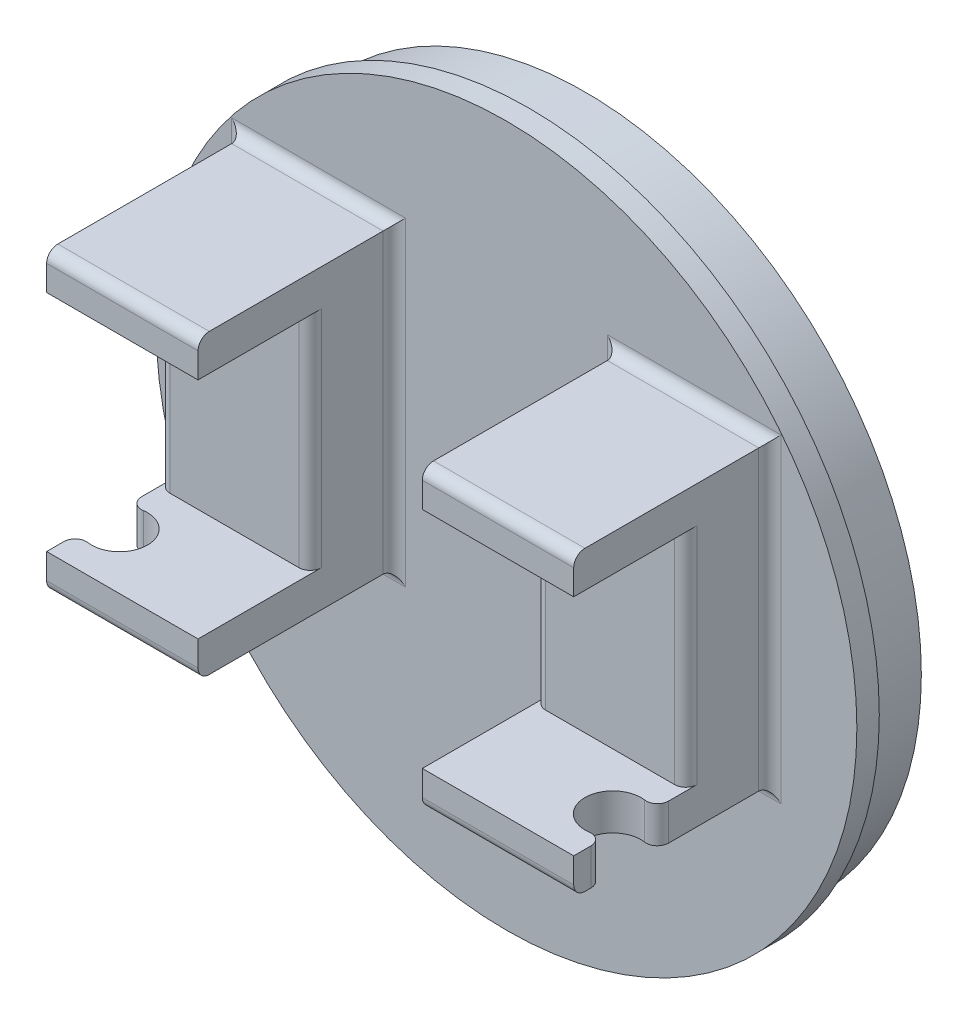
from build123d import *

# Parameters (mm, degrees)
SKETCH1_R           = 62.5
BOSS_EXTRUDE1_DEPTH = 10
SKETCH2_R           = 62.5
BOSS_EXTRUDE2_DEPTH = 2
BOSS_EXTRUDE3_START = 2
SKETCH3_R           = 62.5
BOSS_EXTRUDE3_DEPTH = 2
SKETCH4_R           = 16
CUT_EXTRUDE1_DEPTH  = 10
SKETCH7_W           = 27
SKETCH7_H           = 6.5
BOSS_EXTRUDE4_DEPTH = 35
SKETCH8_R           = 5
CUT_EXTRUDE3_DEPTH  = 10
SKETCH10_W          = 27
SKETCH10_H          = 40
BOSS_EXTRUDE6_DEPTH = 15
FILLET3_R           = 2
SKETCH11_R          = 2
CUT_EXTRUDE4_DEPTH  = 15
SKETCH12_R          = 22.5
CUT_EXTRUDE5_DEPTH  = 10
SKETCH13_R          = 62.5
SKETCH13_R_2        = 60
CUT_EXTRUDE6_DEPTH  = 10


with BuildPart() as part:
    # Sketch1 → Boss-Extrude1 (new body)
    with BuildSketch(Plane.XY):
        Circle(SKETCH1_R)
    extrude(amount=BOSS_EXTRUDE1_DEPTH)

    # Sketch2 → Boss-Extrude2 (add)
    with BuildSketch(Plane.XY.offset(10)):
        Circle(SKETCH2_R)
    extrude(amount=BOSS_EXTRUDE2_DEPTH)

    # Sketch3 → Boss-Extrude3 (add)
    with BuildSketch(Plane(origin=(0, 0, 0), x_dir=(-1, 0, 0), z_dir=(0, 0, -1)).offset(BOSS_EXTRUDE3_START)):
        Circle(SKETCH3_R)
    extrude(amount=-BOSS_EXTRUDE3_DEPTH)

    # Sketch4 → Cut-Extrude1 (cut)
    with BuildSketch(Plane(origin=(0, 0, -2), x_dir=(-1, 0, 0), z_dir=(0, 0, -1))):
        Circle(SKETCH4_R)
    extrude(amount=-CUT_EXTRUDE1_DEPTH, mode=Mode.SUBTRACT)

    # Sketch7 → Boss-Extrude4 (add)
    with BuildSketch(Plane.XY.offset(12)):
        with Locations((-33.5, -13.25)):
            Rectangle(SKETCH7_W, SKETCH7_H)
        with Locations((33.5, -13.25)):
            Rectangle(SKETCH7_W, SKETCH7_H)
        with Locations((-33.5, 33.25)):
            Rectangle(SKETCH7_W, SKETCH7_H)
        with Locations((33.5, 33.25)):
            Rectangle(SKETCH7_W, SKETCH7_H)
    extrude(amount=BOSS_EXTRUDE4_DEPTH)

    # Sketch8 → Cut-Extrude3 (cut)
    with BuildSketch(Plane.XZ.offset(16.5)):
        with Locations((-44, 37)):
            Circle(SKETCH8_R)
        with Locations((44, 37)):
            Circle(SKETCH8_R)
    extrude(amount=-CUT_EXTRUDE3_DEPTH, mode=Mode.SUBTRACT)

    # Sketch10 → Boss-Extrude6 (add)
    with BuildSketch(Plane.XY.offset(12)):
        with Locations((-33.5, 10)):
            Rectangle(SKETCH10_W, SKETCH10_H)
        with Locations((33.5, 10)):
            Rectangle(SKETCH10_W, SKETCH10_H)
    extrude(amount=BOSS_EXTRUDE6_DEPTH)

    # Fillet3
    # the kernel refuses this fillet: 2 mm, written as the material it adds along each edge
    with BuildSketch(Plane(origin=(-47, -10, 12), x_dir=(-1, 0, 0), z_dir=(0, 1, 0)), Plane(origin=(-20, 30, 12), x_dir=(1, 0, 0), z_dir=(0, -1, 0)), Plane(origin=(47, 30, 12), x_dir=(1, 0, 0), z_dir=(0, -1, 0)), Plane(origin=(20, -10, 12), x_dir=(-1, 0, 0), z_dir=(0, 1, 0))) as fillet3_piece_1:
        with BuildLine():
            CenterArc((FILLET3_R, FILLET3_R), FILLET3_R, 180, 90)
            Line((0, FILLET3_R), (0, 0))
            Line((0, 0), (FILLET3_R, 0))
        make_face()
    extrude(amount=40)
    with BuildSketch(Plane(origin=(-20, -16.5, 12), x_dir=(0, -1, 0), z_dir=(-1, 0, 0)), Plane(origin=(-47, 36.5, 12), x_dir=(0, 1, 0), z_dir=(1, 0, 0)), Plane(origin=(20, 36.5, 12), x_dir=(0, 1, 0), z_dir=(1, 0, 0))) as fillet3_piece_2:
        with BuildLine():
            CenterArc((FILLET3_R, FILLET3_R), FILLET3_R, 180, 90)
            Line((0, FILLET3_R), (0, 0))
            Line((0, 0), (FILLET3_R, 0))
        make_face()
    extrude(amount=27)
    with BuildSketch(Plane(origin=(20, -16.5, 12), x_dir=(0, -1, 0), z_dir=(1, 0, 0))) as fillet3_piece_3:
        with BuildLine():
            CenterArc((FILLET3_R, -FILLET3_R), FILLET3_R, 90, 90)
            Line((0, -FILLET3_R), (0, 0))
            Line((0, 0), (FILLET3_R, 0))
        make_face()
    extrude(amount=27)
    with BuildSketch(Plane(origin=(20, -10, 12), x_dir=(-1, 0, 0), z_dir=(0, -1, 0)), Plane(origin=(47, -16.5, 12), x_dir=(1, 0, 0), z_dir=(0, 1, 0))) as fillet3_piece_4:
        with BuildLine():
            CenterArc((FILLET3_R, -FILLET3_R), FILLET3_R, 90, 90)
            Line((0, -FILLET3_R), (0, 0))
            Line((0, 0), (FILLET3_R, 0))
        make_face()
    extrude(amount=6.5)
    with BuildSketch(Plane(origin=(20, 30, 12), x_dir=(-1, 0, 0), z_dir=(0, 1, 0)), Plane(origin=(47, 36.5, 12), x_dir=(1, 0, 0), z_dir=(0, -1, 0)), Plane(origin=(-20, 36.5, 12), x_dir=(1, 0, 0), z_dir=(0, -1, 0)), Plane(origin=(-20, -10, 12), x_dir=(1, 0, 0), z_dir=(0, -1, 0)), Plane(origin=(-47, -16.5, 12), x_dir=(-1, 0, 0), z_dir=(0, 1, 0)), Plane(origin=(-47, 30, 12), x_dir=(-1, 0, 0), z_dir=(0, 1, 0))) as fillet3_piece_5:
        with BuildLine():
            CenterArc((FILLET3_R, FILLET3_R), FILLET3_R, 180, 90)
            Line((0, FILLET3_R), (0, 0))
            Line((0, 0), (FILLET3_R, 0))
        make_face()
    extrude(amount=6.5)
    with BuildSketch(Plane(origin=(-15, -16.5, 12), x_dir=(0, -1, 0), z_dir=(-1, 0, 0))) as fillet3_piece_6a_section:
        with BuildLine():
            CenterArc((FILLET3_R, FILLET3_R), FILLET3_R, 180, 90)
            Line((0, FILLET3_R), (0, 0))
            Line((0, 0), (FILLET3_R, 0))
        make_face()
    fillet3_piece_6a = extrude(amount=32, mode=Mode.PRIVATE)
    fillet3_piece_6a = split(fillet3_piece_6a, bisect_by=Plane(origin=(-20, -16.952790229, 12.452790229), z_dir=(1, 0, 0)), keep=Keep.TOP, mode=Mode.PRIVATE)
    with BuildSketch(Plane(origin=(-20, -10, 12), x_dir=(1, 0, 0), z_dir=(0, -1, 0))) as fillet3_piece_6b_section:
        with BuildLine():
            CenterArc((FILLET3_R, FILLET3_R), FILLET3_R, 180, 90)
            Line((0, FILLET3_R), (0, 0))
            Line((0, 0), (FILLET3_R, 0))
        make_face()
    fillet3_piece_6b = extrude(amount=11.5, mode=Mode.PRIVATE)
    fillet3_piece_6b = split(fillet3_piece_6b, bisect_by=Plane(origin=(-19.547209771, -16.5, 12.452790229), z_dir=(0, -1, 0)), keep=Keep.TOP, mode=Mode.PRIVATE)
    fillet3_piece_6 = fillet3_piece_6a & fillet3_piece_6b
    add(fillet3_piece_6)
    with BuildSketch(Plane(origin=(-20, -16.5, 12), x_dir=(0, -1, 0), z_dir=(-1, 0, 0))) as fillet3_piece_7a_section:
        with BuildLine():
            CenterArc((FILLET3_R, FILLET3_R), FILLET3_R, 180, 90)
            Line((0, FILLET3_R), (0, 0))
            Line((0, 0), (FILLET3_R, 0))
        make_face()
    fillet3_piece_7a = extrude(amount=32, mode=Mode.PRIVATE)
    fillet3_piece_7a = split(fillet3_piece_7a, bisect_by=Plane(origin=(-47, -16.952790229, 12.452790229), z_dir=(-1, 0, 0)), keep=Keep.TOP, mode=Mode.PRIVATE)
    with BuildSketch(Plane(origin=(-47, -21.5, 12), x_dir=(-1, 0, 0), z_dir=(0, 1, 0))) as fillet3_piece_7b_section:
        with BuildLine():
            CenterArc((FILLET3_R, FILLET3_R), FILLET3_R, 180, 90)
            Line((0, FILLET3_R), (0, 0))
            Line((0, 0), (FILLET3_R, 0))
        make_face()
    fillet3_piece_7b = extrude(amount=11.5, mode=Mode.PRIVATE)
    fillet3_piece_7b = split(fillet3_piece_7b, bisect_by=Plane(origin=(-47.452790229, -16.5, 12.452790229), z_dir=(0, -1, 0)), keep=Keep.TOP, mode=Mode.PRIVATE)
    fillet3_piece_7 = fillet3_piece_7a & fillet3_piece_7b
    add(fillet3_piece_7)
    with BuildSketch(Plane(origin=(15, -16.5, 12), x_dir=(0, -1, 0), z_dir=(1, 0, 0))) as fillet3_piece_8a_section:
        with BuildLine():
            CenterArc((FILLET3_R, -FILLET3_R), FILLET3_R, 90, 90)
            Line((0, -FILLET3_R), (0, 0))
            Line((0, 0), (FILLET3_R, 0))
        make_face()
    fillet3_piece_8a = extrude(amount=32, mode=Mode.PRIVATE)
    fillet3_piece_8a = split(fillet3_piece_8a, bisect_by=Plane(origin=(20, -16.952790229, 12.452790229), z_dir=(-1, 0, 0)), keep=Keep.TOP, mode=Mode.PRIVATE)
    with BuildSketch(Plane(origin=(20, -10, 12), x_dir=(-1, 0, 0), z_dir=(0, -1, 0))) as fillet3_piece_8b_section:
        with BuildLine():
            CenterArc((FILLET3_R, -FILLET3_R), FILLET3_R, 90, 90)
            Line((0, -FILLET3_R), (0, 0))
            Line((0, 0), (FILLET3_R, 0))
        make_face()
    fillet3_piece_8b = extrude(amount=11.5, mode=Mode.PRIVATE)
    fillet3_piece_8b = split(fillet3_piece_8b, bisect_by=Plane(origin=(19.547209771, -16.5, 12.452790229), z_dir=(0, -1, 0)), keep=Keep.TOP, mode=Mode.PRIVATE)
    fillet3_piece_8 = fillet3_piece_8a & fillet3_piece_8b
    add(fillet3_piece_8)
    with BuildSketch(Plane(origin=(20, -16.5, 12), x_dir=(0, -1, 0), z_dir=(1, 0, 0))) as fillet3_piece_9a_section:
        with BuildLine():
            CenterArc((FILLET3_R, -FILLET3_R), FILLET3_R, 90, 90)
            Line((0, -FILLET3_R), (0, 0))
            Line((0, 0), (FILLET3_R, 0))
        make_face()
    fillet3_piece_9a = extrude(amount=32, mode=Mode.PRIVATE)
    fillet3_piece_9a = split(fillet3_piece_9a, bisect_by=Plane(origin=(47, -16.952790229, 12.452790229), z_dir=(1, 0, 0)), keep=Keep.TOP, mode=Mode.PRIVATE)
    with BuildSketch(Plane(origin=(47, -21.5, 12), x_dir=(1, 0, 0), z_dir=(0, 1, 0))) as fillet3_piece_9b_section:
        with BuildLine():
            CenterArc((FILLET3_R, -FILLET3_R), FILLET3_R, 90, 90)
            Line((0, -FILLET3_R), (0, 0))
            Line((0, 0), (FILLET3_R, 0))
        make_face()
    fillet3_piece_9b = extrude(amount=11.5, mode=Mode.PRIVATE)
    fillet3_piece_9b = split(fillet3_piece_9b, bisect_by=Plane(origin=(47.452790229, -16.5, 12.452790229), z_dir=(0, -1, 0)), keep=Keep.TOP, mode=Mode.PRIVATE)
    fillet3_piece_9 = fillet3_piece_9a & fillet3_piece_9b
    add(fillet3_piece_9)
    with BuildSketch(Plane(origin=(-52, 36.5, 12), x_dir=(0, 1, 0), z_dir=(1, 0, 0))) as fillet3_piece_10a_section:
        with BuildLine():
            CenterArc((FILLET3_R, FILLET3_R), FILLET3_R, 180, 90)
            Line((0, FILLET3_R), (0, 0))
            Line((0, 0), (FILLET3_R, 0))
        make_face()
    fillet3_piece_10a = extrude(amount=32, mode=Mode.PRIVATE)
    fillet3_piece_10a = fillet3_piece_10a & Plane(origin=(0, 0, 12.476588428), x_dir=(1, 0, 0), z_dir=(0, 0, -1)) * Cylinder(62.5, 72, mode=Mode.PRIVATE)
    fillet3_piece_10a = split(fillet3_piece_10a, bisect_by=Plane(origin=(-47, 36.91232607, 12.476588428), z_dir=(-1, 0, 0)), keep=Keep.TOP, mode=Mode.PRIVATE)
    with BuildSketch(Plane(origin=(-47, 30, 12), x_dir=(-1, 0, 0), z_dir=(0, 1, 0))) as fillet3_piece_10b_section:
        with BuildLine():
            CenterArc((FILLET3_R, FILLET3_R), FILLET3_R, 180, 90)
            Line((0, FILLET3_R), (0, 0))
            Line((0, 0), (FILLET3_R, 0))
        make_face()
    fillet3_piece_10b = extrude(amount=11.5, mode=Mode.PRIVATE)
    fillet3_piece_10b = fillet3_piece_10b & Plane(origin=(0, 0, 12.48373686), x_dir=(1, 0, 0), z_dir=(0, 0, -1)) * Cylinder(62.5, 31, mode=Mode.PRIVATE)
    fillet3_piece_10b = split(fillet3_piece_10b, bisect_by=Plane(origin=(-47.400122664, 36.5, 12.48373686), z_dir=(0, 1, 0)), keep=Keep.TOP, mode=Mode.PRIVATE)
    fillet3_piece_10 = fillet3_piece_10a & fillet3_piece_10b
    add(fillet3_piece_10)
    with BuildSketch(Plane(origin=(-20, 41.5, 12), x_dir=(1, 0, 0), z_dir=(0, -1, 0))) as fillet3_piece_11a_section:
        with BuildLine():
            CenterArc((FILLET3_R, FILLET3_R), FILLET3_R, 180, 90)
            Line((0, FILLET3_R), (0, 0))
            Line((0, 0), (FILLET3_R, 0))
        make_face()
    fillet3_piece_11a = extrude(amount=11.5, mode=Mode.PRIVATE)
    fillet3_piece_11a = split(fillet3_piece_11a, bisect_by=Plane(origin=(-19.547209771, 36.5, 12.452790229), z_dir=(0, 1, 0)), keep=Keep.TOP, mode=Mode.PRIVATE)
    with BuildSketch(Plane(origin=(-47, 36.5, 12), x_dir=(0, 1, 0), z_dir=(1, 0, 0))) as fillet3_piece_11b_section:
        with BuildLine():
            CenterArc((FILLET3_R, FILLET3_R), FILLET3_R, 180, 90)
            Line((0, FILLET3_R), (0, 0))
            Line((0, 0), (FILLET3_R, 0))
        make_face()
    fillet3_piece_11b = extrude(amount=32, mode=Mode.PRIVATE)
    fillet3_piece_11b = split(fillet3_piece_11b, bisect_by=Plane(origin=(-20, 36.952790229, 12.452790229), z_dir=(1, 0, 0)), keep=Keep.TOP, mode=Mode.PRIVATE)
    fillet3_piece_11 = fillet3_piece_11a & fillet3_piece_11b
    add(fillet3_piece_11)
    with BuildSketch(Plane(origin=(15, 36.5, 12), x_dir=(0, 1, 0), z_dir=(1, 0, 0))) as fillet3_piece_12a_section:
        with BuildLine():
            CenterArc((FILLET3_R, FILLET3_R), FILLET3_R, 180, 90)
            Line((0, FILLET3_R), (0, 0))
            Line((0, 0), (FILLET3_R, 0))
        make_face()
    fillet3_piece_12a = extrude(amount=32, mode=Mode.PRIVATE)
    fillet3_piece_12a = split(fillet3_piece_12a, bisect_by=Plane(origin=(20, 36.952790229, 12.452790229), z_dir=(-1, 0, 0)), keep=Keep.TOP, mode=Mode.PRIVATE)
    with BuildSketch(Plane(origin=(20, 30, 12), x_dir=(-1, 0, 0), z_dir=(0, 1, 0))) as fillet3_piece_12b_section:
        with BuildLine():
            CenterArc((FILLET3_R, FILLET3_R), FILLET3_R, 180, 90)
            Line((0, FILLET3_R), (0, 0))
            Line((0, 0), (FILLET3_R, 0))
        make_face()
    fillet3_piece_12b = extrude(amount=11.5, mode=Mode.PRIVATE)
    fillet3_piece_12b = split(fillet3_piece_12b, bisect_by=Plane(origin=(19.547209771, 36.5, 12.452790229), z_dir=(0, 1, 0)), keep=Keep.TOP, mode=Mode.PRIVATE)
    fillet3_piece_12 = fillet3_piece_12a & fillet3_piece_12b
    add(fillet3_piece_12)
    with BuildSketch(Plane(origin=(47, 41.5, 12), x_dir=(1, 0, 0), z_dir=(0, -1, 0))) as fillet3_piece_13a_section:
        with BuildLine():
            CenterArc((FILLET3_R, FILLET3_R), FILLET3_R, 180, 90)
            Line((0, FILLET3_R), (0, 0))
            Line((0, 0), (FILLET3_R, 0))
        make_face()
    fillet3_piece_13a = extrude(amount=11.5, mode=Mode.PRIVATE)
    fillet3_piece_13a = fillet3_piece_13a & Plane(origin=(0, 0, 12.483736139), x_dir=(1, 0, 0), z_dir=(0, 0, -1)) * Cylinder(62.5, 31, mode=Mode.PRIVATE)
    fillet3_piece_13a = split(fillet3_piece_13a, bisect_by=Plane(origin=(47.400121943, 36.5, 12.483736139), z_dir=(0, 1, 0)), keep=Keep.TOP, mode=Mode.PRIVATE)
    with BuildSketch(Plane(origin=(20, 36.5, 12), x_dir=(0, 1, 0), z_dir=(1, 0, 0))) as fillet3_piece_13b_section:
        with BuildLine():
            CenterArc((FILLET3_R, FILLET3_R), FILLET3_R, 180, 90)
            Line((0, FILLET3_R), (0, 0))
            Line((0, 0), (FILLET3_R, 0))
        make_face()
    fillet3_piece_13b = extrude(amount=32, mode=Mode.PRIVATE)
    fillet3_piece_13b = fillet3_piece_13b & Plane(origin=(0, 0, 12.476588425), x_dir=(1, 0, 0), z_dir=(0, 0, -1)) * Cylinder(62.5, 73, mode=Mode.PRIVATE)
    fillet3_piece_13b = split(fillet3_piece_13b, bisect_by=Plane(origin=(47, 36.912326055, 12.476588425), z_dir=(1, 0, 0)), keep=Keep.TOP, mode=Mode.PRIVATE)
    fillet3_piece_13 = fillet3_piece_13a & fillet3_piece_13b
    add(fillet3_piece_13)
    # the kernel refuses this fillet: 2 mm, written as the material it takes off along each edge
    with BuildSketch(Plane(origin=(47, 30, 27), x_dir=(0, 0, -1), z_dir=(0, -1, 0)), Plane(origin=(20, -10, 27), x_dir=(0, 0, -1), z_dir=(0, 1, 0)), Plane(origin=(-47, -10, 27), x_dir=(0, 0, -1), z_dir=(0, 1, 0)), Plane(origin=(-20, 30, 27), x_dir=(0, 0, -1), z_dir=(0, -1, 0))) as fillet3_2_piece_1:
        with BuildLine():
            CenterArc((FILLET3_R, -FILLET3_R), FILLET3_R, 90, 90)
            Line((0, -FILLET3_R), (0, 0))
            Line((0, 0), (FILLET3_R, 0))
        make_face()
    extrude(amount=40, mode=Mode.SUBTRACT)
    with BuildSketch(Plane(origin=(-15, -16.5, 47), x_dir=(0, 0, -1), z_dir=(-1, 0, 0)), Plane(origin=(-52, 36.5, 47), x_dir=(0, 0, -1), z_dir=(1, 0, 0)), Plane(origin=(15, 36.5, 47), x_dir=(0, 0, -1), z_dir=(1, 0, 0))) as fillet3_2_piece_2:
        with BuildLine():
            CenterArc((FILLET3_R, -FILLET3_R), FILLET3_R, 90, 90)
            Line((0, -FILLET3_R), (0, 0))
            Line((0, 0), (FILLET3_R, 0))
        make_face()
    extrude(amount=37, mode=Mode.SUBTRACT)
    with BuildSketch(Plane(origin=(15, -16.5, 47), x_dir=(0, 0, -1), z_dir=(1, 0, 0))) as fillet3_2_piece_3:
        with BuildLine():
            CenterArc((FILLET3_R, FILLET3_R), FILLET3_R, 180, 90)
            Line((0, FILLET3_R), (0, 0))
            Line((0, 0), (FILLET3_R, 0))
        make_face()
    extrude(amount=37, mode=Mode.SUBTRACT)
    with BuildSketch(Plane(origin=(-47, -2.679491924, 41), x_dir=(0.9236017456605262, 0, 0.38335338189825435), z_dir=(0, -1, 0))) as fillet3_2_piece_4:
        with BuildLine():
            CenterArc((2.969740103, 1.937786851), FILLET3_R, 157.458445826, 98.213210702)
            Line((1.122536611, 2.704493615), (0, 0))
            ThreePointArc((0, 0), (1.237391709, 0.155532872), (2.474783419, 0))
        make_face()
    extrude(amount=21.141016151, mode=Mode.SUBTRACT)
    with BuildSketch(Plane(origin=(-47, -2.679491924, 33), x_dir=(0, 0, -1), z_dir=(0, -1, 0))) as fillet3_2_piece_5:
        with BuildLine():
            CenterArc((2.92820323, 2), FILLET3_R, 171.786789298, 98.213210702)
            ThreePointArc((0.948716593, 2.285714286), (0.618008728, 1.083233091), (0, 0))
            Line((0, 0), (2.92820323, 0))
        make_face()
    extrude(amount=21.141016151, mode=Mode.SUBTRACT)
    with BuildSketch(Plane(origin=(47, -2.679491924, 33), x_dir=(0, 0, -1), z_dir=(0, -1, 0))) as fillet3_2_piece_6:
        with BuildLine():
            CenterArc((2.92820323, -2), FILLET3_R, 90, 98.213210702)
            ThreePointArc((0.948716593, -2.285714286), (0.618008728, -1.083233091), (0, 0))
            Line((0, 0), (2.92820323, 0))
        make_face()
    extrude(amount=21.141016151, mode=Mode.SUBTRACT)
    with BuildSketch(Plane(origin=(47, -2.679491924, 41), x_dir=(-0.9236017456605257, 0, 0.3833533818982558), z_dir=(0, -1, 0))) as fillet3_2_piece_7:
        with BuildLine():
            CenterArc((2.969740103, -1.937786851), FILLET3_R, 104.328343472, 98.213210702)
            Line((1.122536611, -2.704493615), (0, 0))
            ThreePointArc((0, 0), (1.237391709, -0.155532872), (2.474783419, 0))
        make_face()
    extrude(amount=21.141016151, mode=Mode.SUBTRACT)

    # Sketch11 → Cut-Extrude4 (cut)
    with BuildSketch(Plane.XY.offset(12)):
        Circle(SKETCH11_R)
    extrude(amount=-CUT_EXTRUDE4_DEPTH, mode=Mode.SUBTRACT)

    # Sketch12 → Cut-Extrude5 (cut)
    with BuildSketch(Plane(origin=(0, 0, -2), x_dir=(-1, 0, 0), z_dir=(0, 0, -1))):
        with BuildLine():
            Line((-0.461939766, 51.44770063), (-1.407705652, 53.730981458))
            ThreePointArc((-1.407705652, 53.730981458), (-1.887095166, 54.039335156), (-2.343807246, 53.69829207))
            Line((-2.343807246, 53.69829207), (-3.127995674, 51.354599907))
            ThreePointArc((-3.127995674, 51.354599907), (-3.567279265, 51.01447021), (-4.049624682, 51.290153328))
            Line((-4.049624682, 51.290153328), (-5.152360349, 53.501898906))
            ThreePointArc((-5.152360349, 53.501898906), (-5.652091761, 53.776060947), (-6.08390135, 53.403990001))
            Line((-6.08390135, 53.403990001), (-6.702691834, 51.011304734))
            ThreePointArc((-6.702691834, 51.011304734), (-7.117179104, 50.641360702), (-7.617580234, 50.882725555))
            Line((-7.617580234, 50.882725555), (-8.871913264, 53.01216048))
            ThreePointArc((-8.871913264, 53.01216048), (-9.389551933, 53.250795175), (-9.794355298, 52.849509061))
            Line((-9.794355298, 52.849509061), (-10.244733153, 50.419487613))
            ThreePointArc((-10.244733153, 50.419487613), (-10.632404761, 50.021531575), (-11.148423701, 50.227402257))
            Line((-11.148423701, 50.227402257), (-12.54824311, 52.264152136))
            ThreePointArc((-12.54824311, 52.264152136), (-13.081267152, 52.466096881), (-13.457092132, 52.037550625))
            Line((-13.457092132, 52.037550625), (-13.736863162, 49.582031816))
            ThreePointArc((-13.736863162, 49.582031816), (-14.095830411, 49.158002575), (-14.624953168, 49.327376104))
            Line((-14.624953168, 49.327376104), (-16.163439177, 51.261518097))
            ThreePointArc((-16.163439177, 51.261518097), (-16.709251753, 51.425789037), (-17.054267366, 50.972070473))
            Line((-17.054267366, 50.972070473), (-17.162068554, 48.503017344))
            ThreePointArc((-17.162068554, 48.503017344), (-17.490582593, 48.054980727), (-18.030231333, 48.187031934))
            Line((-18.030231333, 48.187031934), (-19.699888593, 50.009143095))
            ThreePointArc((-19.699888593, 50.009143095), (-20.255830558, 50.134939919), (-20.568355924, 49.658259517))
            Line((-20.568355924, 49.658259517), (-20.503662073, 47.187701047))
            ThreePointArc((-20.503662073, 47.187701047), (-20.800122414, 46.717839844), (-21.347668024, 46.811925387))
            Line((-21.347668024, 46.811925387), (-23.140362131, 48.513128575))
            ThreePointArc((-23.140362131, 48.513128575), (-23.703724993, 48.599838412), (-23.982237519, 48.102518513))
            Line((-23.982237519, 48.102518513), (-23.745363812, 45.642491014))
            ThreePointArc((-23.745363812, 45.642491014), (-24.00832613, 45.153094341), (-24.561101021, 45.208755846))
            Line((-24.561101021, 45.208755846), (-26.468098152, 46.780762968))
            ThreePointArc((-26.468098152, 46.780762968), (-27.036137262, 46.827963378), (-27.279280063, 46.312426874))
            Line((-27.279280063, 46.312426874), (-26.871380525, 43.874915352))
            ThreePointArc((-26.871380525, 43.874915352), (-27.099563694, 43.368367501), (-27.654874804, 43.38533379))
            Line((-27.654874804, 43.38533379), (-29.666884259, 44.820486187))
            ThreePointArc((-29.666884259, 44.820486187), (-30.236832189, 44.827947214), (-30.443420697, 44.296705746))
            Line((-30.443420697, 44.296705746), (-29.866482574, 41.893585514))
            ThreePointArc((-29.866482574, 41.893585514), (-30.058774908, 41.372354335), (-30.613916816, 41.35054275))
            Line((-30.613916816, 41.35054275), (-32.721136288, 42.641848503))
            ThreePointArc((-32.721136288, 42.641848503), (-33.290216308, 42.609533797), (-33.459244046, 42.065175521))
            Line((-33.459244046, 42.065175521), (-32.716078121, 39.708154337))
            ThreePointArc((-32.716078121, 39.708154337), (-32.871542792, 39.174779216), (-33.423810903, 39.114296021))
            Line((-33.423810903, 39.114296021), (-35.61597423, 40.255464018))
            ThreePointArc((-35.61597423, 40.255464018), (-36.18141384, 40.183531015), (-36.31205732, 39.628707988))
            Line((-36.31205732, 39.628707988), (-35.406284225, 37.329269025))
            ThreePointArc((-35.406284225, 37.329269025), (-35.524163823, 36.786348511), (-36.070867543, 36.687488374))
            Line((-36.070867543, 36.687488374), (-38.337294726, 37.67295896))
            ThreePointArc((-38.337294726, 37.67295896), (-38.89633916, 37.561758108), (-38.987961902, 36.999173374))
            Line((-38.987961902, 36.999173374), (-37.92399447, 34.768519266))
            ThreePointArc((-37.92399447, 34.768519266), (-38.0037147, 34.218698414), (-38.542190542, 34.081942972))
            Line((-38.542190542, 34.081942972), (-40.871839775, 34.906915033))
            ThreePointArc((-40.871839775, 34.906915033), (-41.421765426, 34.756988092), (-41.473921053, 34.189382507))
            Line((-41.473921053, 34.189382507), (-40.256942827, 32.038380776))
            ThreePointArc((-40.256942827, 32.038380776), (-40.298115298, 31.484338258), (-40.825739863, 31.310353769))
            Line((-40.825739863, 31.310353769), (-43.207261329, 31.970808124))
            ThreePointArc((-43.207261329, 31.970808124), (-43.745389015, 31.782885523), (-43.757823429, 31.213024405))
            Line((-43.757823429, 31.213024405), (-42.393763405, 29.152154515))
            ThreePointArc((-42.393763405, 29.152154515), (-42.39618753, 28.596589571), (-42.910390283, 28.38622367))
            Line((-42.910390283, 28.38622367), (-45.33218145, 28.878942652))
            ThreePointArc((-45.33218145, 28.878942652), (-45.855889465, 28.653939931), (-45.828542087, 28.084599585))
            Line((-45.828542087, 28.084599585), (-44.324045829, 26.123901888))
            ThreePointArc((-44.324045829, 26.123901888), (-44.287709797, 25.569521173), (-44.785985595, 25.323798743))
            Line((-44.785985595, 25.323798743), (-47.236247739, 25.646381874))
            ThreePointArc((-47.236247739, 25.646381874), (-47.742984632, 25.385395224), (-47.675988696, 24.819349419))
            Line((-47.675988696, 24.819349419), (-46.038385957, 22.968376237))
            ThreePointArc((-46.038385957, 22.968376237), (-45.963466795, 22.417880639), (-46.443388088, 22.137998813))
            Line((-46.443388088, 22.137998813), (-48.910183777, 22.288874501))
            ThreePointArc((-48.910183777, 22.288874501), (-49.397480776, 21.993175424), (-49.291162679, 21.433181877))
            Line((-49.291162679, 21.433181877), (-47.528431697, 19.700950965))
            ThreePointArc((-47.528431697, 19.700950965), (-47.415294402, 19.157022444), (-47.874523061, 18.844344779))
            Line((-47.874523061, 18.844344779), (-50.345834317, 18.822777973))
            ThreePointArc((-50.345834317, 18.822777973), (-50.81131736, 18.493807083), (-50.666195073, 17.942594028))
            Line((-50.666195073, 17.942594028), (-48.786923695, 16.337544641))
            ThreePointArc((-48.786923695, 16.337544641), (-48.636119461, 15.802833161), (-49.072418171, 15.458882992))
            Line((-49.072418171, 15.458882992), (-51.536205012, 15.264978762))
            ThreePointArc((-51.536205012, 15.264978762), (-51.977606312, 14.904338773), (-51.794386858, 14.364591665))
            Line((-51.794386858, 14.364591665), (-49.807730705, 12.894543442))
            ThreePointArc((-49.807730705, 12.894543442), (-49.619994235, 12.371654064), (-50.031237392, 11.99810708))
            Line((-50.031237392, 11.99810708), (-52.475496497, 11.632810109))
            ThreePointArc((-52.475496497, 11.632810109), (-52.890665592, 11.242258023), (-52.670241596, 10.716606454))
            Line((-52.670241596, 10.716606454), (-50.585879457, 9.388721323))
            ThreePointArc((-50.585879457, 9.388721323), (-50.362125385, 8.880201511), (-50.746309454, 8.478877596))
            Line((-50.746309454, 8.478877596), (-53.159132638, 7.943967575))
            ThreePointArc((-53.159132638, 7.943967575), (-53.546046866, 7.525406122), (-53.289492211, 7.016411015))
            Line((-53.289492211, 7.016411015), (-51.117578889, 5.837158297))
            ThreePointArc((-51.117578889, 5.837158297), (-50.858897322, 5.345485509), (-51.214150597, 4.918339874))
            Line((-51.214150597, 4.918339874), (-53.583782828, 4.216422829))
            ThreePointArc((-53.583782828, 4.216422829), (-53.940557181, 3.771891198), (-53.649121777, 3.282032326))
            Line((-53.649121777, 3.282032326), (-51.400238616, 2.257157224))
            ThreePointArc((-51.400238616, 2.257157224), (-51.107889824, 1.78472684), (-51.432481547, 1.333840493))
            Line((-51.432481547, 1.333840493), (-53.747378215, 0.468336095))
            ThreePointArc((-53.747378215, 0.468336095), (-54.072274524, 0), (-53.747378215, -0.468336095))
            Line((-53.747378215, -0.468336095), (-51.432481547, -1.333840493))
            ThreePointArc((-51.432481547, -1.333840493), (-51.107889824, -1.78472684), (-51.400238616, -2.257157224))
            Line((-51.400238616, -2.257157224), (-53.649121777, -3.282032326))
            ThreePointArc((-53.649121777, -3.282032326), (-53.940557181, -3.771891198), (-53.583782828, -4.216422829))
            Line((-53.583782828, -4.216422829), (-51.214150597, -4.918339874))
            ThreePointArc((-51.214150597, -4.918339874), (-50.858897322, -5.345485509), (-51.117578889, -5.837158297))
            Line((-51.117578889, -5.837158297), (-53.289492211, -7.016411015))
            ThreePointArc((-53.289492211, -7.016411015), (-53.546046866, -7.525406121), (-53.159132638, -7.943967575))
            Line((-53.159132638, -7.943967575), (-50.746309454, -8.478877596))
            ThreePointArc((-50.746309454, -8.478877596), (-50.362125385, -8.880201511), (-50.585879457, -9.388721323))
            Line((-50.585879457, -9.388721323), (-52.670241596, -10.716606454))
            ThreePointArc((-52.670241596, -10.716606454), (-52.890665592, -11.242258023), (-52.475496497, -11.632810109))
            Line((-52.475496497, -11.632810109), (-50.031237392, -11.99810708))
            ThreePointArc((-50.031237392, -11.99810708), (-49.619994235, -12.371654064), (-49.807730705, -12.894543442))
            Line((-49.807730705, -12.894543442), (-51.794386858, -14.364591665))
            ThreePointArc((-51.794386858, -14.364591665), (-51.977606312, -14.904338773), (-51.536205012, -15.264978762))
            Line((-51.536205012, -15.264978762), (-49.072418171, -15.458882991))
            ThreePointArc((-49.072418171, -15.458882991), (-48.636119461, -15.802833161), (-48.786923695, -16.337544641))
            Line((-48.786923695, -16.337544641), (-50.666195073, -17.942594028))
            ThreePointArc((-50.666195073, -17.942594028), (-50.81131736, -18.493807083), (-50.345834317, -18.822777973))
            Line((-50.345834317, -18.822777973), (-47.874523061, -18.844344779))
            ThreePointArc((-47.874523061, -18.844344779), (-47.415294402, -19.157022444), (-47.528431697, -19.700950965))
            Line((-47.528431697, -19.700950965), (-49.291162679, -21.433181877))
            ThreePointArc((-49.291162679, -21.433181877), (-49.397480776, -21.993175423), (-48.910183778, -22.288874501))
            Line((-48.910183778, -22.288874501), (-46.443388088, -22.137998813))
            ThreePointArc((-46.443388088, -22.137998813), (-45.963466795, -22.417880639), (-46.038385957, -22.968376237))
            Line((-46.038385957, -22.968376237), (-47.675988696, -24.819349419))
            ThreePointArc((-47.675988696, -24.819349419), (-47.742984632, -25.385395224), (-47.236247739, -25.646381874))
            Line((-47.236247739, -25.646381874), (-44.785985595, -25.323798743))
            ThreePointArc((-44.785985595, -25.323798743), (-44.287709797, -25.569521173), (-44.324045829, -26.123901888))
            Line((-44.324045829, -26.123901888), (-45.828542087, -28.084599585))
            ThreePointArc((-45.828542087, -28.084599585), (-45.855889465, -28.653939931), (-45.33218145, -28.878942652))
            Line((-45.33218145, -28.878942652), (-42.910390283, -28.38622367))
            ThreePointArc((-42.910390283, -28.38622367), (-42.39618753, -28.596589571), (-42.393763405, -29.152154515))
            Line((-42.393763405, -29.152154515), (-43.757823429, -31.213024404))
            ThreePointArc((-43.757823429, -31.213024404), (-43.745389015, -31.782885523), (-43.207261329, -31.970808124))
            Line((-43.207261329, -31.970808124), (-40.825739863, -31.310353769))
            ThreePointArc((-40.825739863, -31.310353769), (-40.298115298, -31.484338258), (-40.256942827, -32.038380776))
            Line((-40.256942827, -32.038380776), (-41.473921053, -34.189382507))
            ThreePointArc((-41.473921053, -34.189382507), (-41.421765426, -34.756988092), (-40.871839775, -34.906915032))
            Line((-40.871839775, -34.906915032), (-38.542190542, -34.081942972))
            ThreePointArc((-38.542190542, -34.081942972), (-38.0037147, -34.218698414), (-37.92399447, -34.768519266))
            Line((-37.92399447, -34.768519266), (-38.987961902, -36.999173374))
            ThreePointArc((-38.987961902, -36.999173374), (-38.89633916, -37.561758108), (-38.337294726, -37.67295896))
            Line((-38.337294726, -37.67295896), (-36.070867543, -36.687488374))
            ThreePointArc((-36.070867543, -36.687488374), (-35.524163823, -36.786348511), (-35.406284225, -37.329269025))
            Line((-35.406284225, -37.329269025), (-36.31205732, -39.628707988))
            ThreePointArc((-36.31205732, -39.628707988), (-36.18141384, -40.183531015), (-35.61597423, -40.255464018))
            Line((-35.61597423, -40.255464018), (-33.423810903, -39.114296021))
            ThreePointArc((-33.423810903, -39.114296021), (-32.871542792, -39.174779216), (-32.716078121, -39.708154337))
            Line((-32.716078121, -39.708154337), (-33.459244046, -42.065175521))
            ThreePointArc((-33.459244046, -42.065175521), (-33.290216308, -42.609533797), (-32.721136288, -42.641848502))
            Line((-32.721136288, -42.641848502), (-30.613916816, -41.35054275))
            ThreePointArc((-30.613916816, -41.35054275), (-30.058774908, -41.372354335), (-29.866482574, -41.893585514))
            Line((-29.866482574, -41.893585514), (-30.443420697, -44.296705746))
            ThreePointArc((-30.443420697, -44.296705746), (-30.236832189, -44.827947214), (-29.666884259, -44.820486187))
            Line((-29.666884259, -44.820486187), (-27.654874804, -43.38533379))
            ThreePointArc((-27.654874804, -43.38533379), (-27.099563694, -43.368367501), (-26.871380525, -43.874915352))
            Line((-26.871380525, -43.874915352), (-27.279280063, -46.312426874))
            ThreePointArc((-27.279280063, -46.312426874), (-27.036137262, -46.827963378), (-26.468098152, -46.780762968))
            Line((-26.468098152, -46.780762968), (-24.561101021, -45.208755846))
            ThreePointArc((-24.561101021, -45.208755846), (-24.00832613, -45.153094341), (-23.745363812, -45.642491014))
            Line((-23.745363812, -45.642491014), (-23.982237519, -48.102518513))
            ThreePointArc((-23.982237519, -48.102518513), (-23.703724993, -48.599838412), (-23.140362131, -48.513128575))
            Line((-23.140362131, -48.513128575), (-21.347668024, -46.811925387))
            ThreePointArc((-21.347668024, -46.811925387), (-20.800122414, -46.717839844), (-20.503662073, -47.187701047))
            Line((-20.503662073, -47.187701047), (-20.568355924, -49.658259517))
            ThreePointArc((-20.568355924, -49.658259517), (-20.255830558, -50.134939919), (-19.699888593, -50.009143095))
            Line((-19.699888593, -50.009143095), (-18.030231333, -48.187031934))
            ThreePointArc((-18.030231333, -48.187031934), (-17.490582593, -48.054980727), (-17.162068554, -48.503017344))
            Line((-17.162068554, -48.503017344), (-17.054267366, -50.972070473))
            ThreePointArc((-17.054267366, -50.972070473), (-16.709251753, -51.425789037), (-16.163439177, -51.261518097))
            Line((-16.163439177, -51.261518097), (-14.624953168, -49.327376104))
            ThreePointArc((-14.624953168, -49.327376104), (-14.095830411, -49.158002575), (-13.736863162, -49.582031816))
            Line((-13.736863162, -49.582031816), (-13.457092132, -52.037550625))
            ThreePointArc((-13.457092132, -52.037550625), (-13.081267152, -52.466096881), (-12.54824311, -52.264152136))
            Line((-12.54824311, -52.264152136), (-11.148423701, -50.227402257))
            ThreePointArc((-11.148423701, -50.227402257), (-10.632404761, -50.021531575), (-10.244733153, -50.419487613))
            Line((-10.244733153, -50.419487613), (-9.794355298, -52.849509061))
            ThreePointArc((-9.794355298, -52.849509061), (-9.389551933, -53.250795175), (-8.871913264, -53.01216048))
            Line((-8.871913264, -53.01216048), (-7.617580234, -50.882725555))
            ThreePointArc((-7.617580234, -50.882725555), (-7.117179104, -50.641360702), (-6.702691834, -51.011304734))
            Line((-6.702691834, -51.011304734), (-6.08390135, -53.403990001))
            ThreePointArc((-6.08390135, -53.403990001), (-5.652091761, -53.776060947), (-5.152360349, -53.501898906))
            Line((-5.152360349, -53.501898906), (-4.049624682, -51.290153328))
            ThreePointArc((-4.049624682, -51.290153328), (-3.567279265, -51.01447021), (-3.127995674, -51.354599907))
            Line((-3.127995674, -51.354599907), (-2.343807246, -53.69829207))
            ThreePointArc((-2.343807246, -53.69829207), (-1.887095166, -54.039335156), (-1.407705652, -53.730981458))
            Line((-1.407705652, -53.730981458), (-0.461939766, -51.44770063))
            ThreePointArc((-0.461939766, -51.44770063), (0, -51.139042347), (0.461939766, -51.44770063))
            Line((0.461939766, -51.44770063), (1.407705652, -53.730981458))
            ThreePointArc((1.407705652, -53.730981458), (1.887095166, -54.039335156), (2.343807246, -53.69829207))
            Line((2.343807246, -53.69829207), (3.127995674, -51.354599907))
            ThreePointArc((3.127995674, -51.354599907), (3.567279265, -51.01447021), (4.049624682, -51.290153328))
            Line((4.049624682, -51.290153328), (5.152360349, -53.501898906))
            ThreePointArc((5.152360349, -53.501898906), (5.652091761, -53.776060947), (6.08390135, -53.403990001))
            Line((6.08390135, -53.403990001), (6.702691834, -51.011304734))
            ThreePointArc((6.702691834, -51.011304734), (7.117179103, -50.641360702), (7.617580234, -50.882725555))
            Line((7.617580234, -50.882725555), (8.871913264, -53.01216048))
            ThreePointArc((8.871913264, -53.01216048), (9.389551933, -53.250795175), (9.794355298, -52.849509061))
            Line((9.794355298, -52.849509061), (10.244733153, -50.419487613))
            ThreePointArc((10.244733153, -50.419487613), (10.632404761, -50.021531575), (11.148423701, -50.227402257))
            Line((11.148423701, -50.227402257), (12.54824311, -52.264152136))
            ThreePointArc((12.54824311, -52.264152136), (13.081267152, -52.466096881), (13.457092132, -52.037550625))
            Line((13.457092132, -52.037550625), (13.736863162, -49.582031816))
            ThreePointArc((13.736863162, -49.582031816), (14.095830411, -49.158002575), (14.624953168, -49.327376104))
            Line((14.624953168, -49.327376104), (16.163439177, -51.261518097))
            ThreePointArc((16.163439177, -51.261518097), (16.709251753, -51.425789037), (17.054267366, -50.972070473))
            Line((17.054267366, -50.972070473), (17.162068554, -48.503017344))
            ThreePointArc((17.162068554, -48.503017344), (17.490582593, -48.054980727), (18.030231333, -48.187031934))
            Line((18.030231333, -48.187031934), (19.699888593, -50.009143095))
            ThreePointArc((19.699888593, -50.009143095), (20.255830558, -50.134939919), (20.568355924, -49.658259517))
            Line((20.568355924, -49.658259517), (20.503662073, -47.187701047))
            ThreePointArc((20.503662073, -47.187701047), (20.800122414, -46.717839844), (21.347668024, -46.811925387))
            Line((21.347668024, -46.811925387), (23.140362131, -48.513128575))
            ThreePointArc((23.140362131, -48.513128575), (23.703724993, -48.599838412), (23.982237518, -48.102518513))
            Line((23.982237518, -48.102518513), (23.745363812, -45.642491014))
            ThreePointArc((23.745363812, -45.642491014), (24.00832613, -45.153094341), (24.561101021, -45.208755846))
            Line((24.561101021, -45.208755846), (26.468098152, -46.780762968))
            ThreePointArc((26.468098152, -46.780762968), (27.036137262, -46.827963378), (27.279280063, -46.312426874))
            Line((27.279280063, -46.312426874), (26.871380525, -43.874915352))
            ThreePointArc((26.871380525, -43.874915352), (27.099563694, -43.368367501), (27.654874804, -43.38533379))
            Line((27.654874804, -43.38533379), (29.666884259, -44.820486187))
            ThreePointArc((29.666884259, -44.820486187), (30.236832188, -44.827947214), (30.443420697, -44.296705746))
            Line((30.443420697, -44.296705746), (29.866482574, -41.893585514))
            ThreePointArc((29.866482574, -41.893585514), (30.058774908, -41.372354335), (30.613916816, -41.35054275))
            Line((30.613916816, -41.35054275), (32.721136288, -42.641848502))
            ThreePointArc((32.721136288, -42.641848502), (33.290216308, -42.609533797), (33.459244046, -42.065175521))
            Line((33.459244046, -42.065175521), (32.716078121, -39.708154337))
            ThreePointArc((32.716078121, -39.708154337), (32.871542792, -39.174779216), (33.423810903, -39.114296021))
            Line((33.423810903, -39.114296021), (35.61597423, -40.255464018))
            ThreePointArc((35.61597423, -40.255464018), (36.18141384, -40.183531015), (36.31205732, -39.628707988))
            Line((36.31205732, -39.628707988), (35.406284225, -37.329269025))
            ThreePointArc((35.406284225, -37.329269025), (35.524163823, -36.786348511), (36.070867543, -36.687488374))
            Line((36.070867543, -36.687488374), (38.337294726, -37.67295896))
            ThreePointArc((38.337294726, -37.67295896), (38.89633916, -37.561758108), (38.987961902, -36.999173374))
            Line((38.987961902, -36.999173374), (37.92399447, -34.768519266))
            ThreePointArc((37.92399447, -34.768519266), (38.0037147, -34.218698414), (38.542190542, -34.081942972))
            Line((38.542190542, -34.081942972), (40.871839775, -34.906915032))
            ThreePointArc((40.871839775, -34.906915032), (41.421765426, -34.756988092), (41.473921053, -34.189382507))
            Line((41.473921053, -34.189382507), (40.256942827, -32.038380776))
            ThreePointArc((40.256942827, -32.038380776), (40.298115298, -31.484338258), (40.825739863, -31.310353769))
            Line((40.825739863, -31.310353769), (43.207261329, -31.970808124))
            ThreePointArc((43.207261329, -31.970808124), (43.745389015, -31.782885523), (43.757823429, -31.213024404))
            Line((43.757823429, -31.213024404), (42.393763405, -29.152154515))
            ThreePointArc((42.393763405, -29.152154515), (42.39618753, -28.596589571), (42.910390283, -28.38622367))
            Line((42.910390283, -28.38622367), (45.33218145, -28.878942652))
            ThreePointArc((45.33218145, -28.878942652), (45.855889465, -28.653939931), (45.828542087, -28.084599585))
            Line((45.828542087, -28.084599585), (44.324045829, -26.123901888))
            ThreePointArc((44.324045829, -26.123901888), (44.287709797, -25.569521173), (44.785985595, -25.323798743))
            Line((44.785985595, -25.323798743), (47.236247739, -25.646381874))
            ThreePointArc((47.236247739, -25.646381874), (47.742984632, -25.385395224), (47.675988696, -24.819349419))
            Line((47.675988696, -24.819349419), (46.038385957, -22.968376237))
            ThreePointArc((46.038385957, -22.968376237), (45.963466795, -22.417880639), (46.443388088, -22.137998813))
            Line((46.443388088, -22.137998813), (48.910183777, -22.288874501))
            ThreePointArc((48.910183777, -22.288874501), (49.397480776, -21.993175423), (49.291162679, -21.433181877))
            Line((49.291162679, -21.433181877), (47.528431697, -19.700950965))
            ThreePointArc((47.528431697, -19.700950965), (47.415294402, -19.157022444), (47.874523061, -18.844344779))
            Line((47.874523061, -18.844344779), (50.345834317, -18.822777973))
            ThreePointArc((50.345834317, -18.822777973), (50.81131736, -18.493807083), (50.666195073, -17.942594028))
            Line((50.666195073, -17.942594028), (48.786923695, -16.337544641))
            ThreePointArc((48.786923695, -16.337544641), (48.636119461, -15.802833161), (49.072418171, -15.458882992))
            Line((49.072418171, -15.458882992), (51.536205012, -15.264978762))
            ThreePointArc((51.536205012, -15.264978762), (51.977606312, -14.904338773), (51.794386858, -14.364591665))
            Line((51.794386858, -14.364591665), (49.807730705, -12.894543442))
            ThreePointArc((49.807730705, -12.894543442), (49.619994235, -12.371654064), (50.031237392, -11.99810708))
            Line((50.031237392, -11.99810708), (52.475496497, -11.632810109))
            ThreePointArc((52.475496497, -11.632810109), (52.890665592, -11.242258023), (52.670241596, -10.716606454))
            Line((52.670241596, -10.716606454), (50.585879457, -9.388721323))
            ThreePointArc((50.585879457, -9.388721323), (50.362125385, -8.880201511), (50.746309454, -8.478877596))
            Line((50.746309454, -8.478877596), (53.159132638, -7.943967575))
            ThreePointArc((53.159132638, -7.943967575), (53.546046866, -7.525406122), (53.289492211, -7.016411015))
            Line((53.289492211, -7.016411015), (51.117578889, -5.837158297))
            ThreePointArc((51.117578889, -5.837158297), (50.858897322, -5.345485509), (51.214150597, -4.918339874))
            Line((51.214150597, -4.918339874), (53.583782828, -4.216422829))
            ThreePointArc((53.583782828, -4.216422829), (53.940557181, -3.771891198), (53.649121777, -3.282032326))
            Line((53.649121777, -3.282032326), (51.400238616, -2.257157224))
            ThreePointArc((51.400238616, -2.257157224), (51.107889824, -1.78472684), (51.432481547, -1.333840493))
            Line((51.432481547, -1.333840493), (53.747378215, -0.468336095))
            ThreePointArc((53.747378215, -0.468336095), (54.072274524, 0), (53.747378215, 0.468336095))
            Line((53.747378215, 0.468336095), (51.432481547, 1.333840493))
            ThreePointArc((51.432481547, 1.333840493), (51.107889824, 1.78472684), (51.400238616, 2.257157224))
            Line((51.400238616, 2.257157224), (53.649121777, 3.282032326))
            ThreePointArc((53.649121777, 3.282032326), (53.940557181, 3.771891198), (53.583782828, 4.216422829))
            Line((53.583782828, 4.216422829), (51.214150597, 4.918339874))
            ThreePointArc((51.214150597, 4.918339874), (50.858897322, 5.345485509), (51.117578889, 5.837158297))
            Line((51.117578889, 5.837158297), (53.289492211, 7.016411015))
            ThreePointArc((53.289492211, 7.016411015), (53.546046866, 7.525406122), (53.159132638, 7.943967575))
            Line((53.159132638, 7.943967575), (50.746309454, 8.478877596))
            ThreePointArc((50.746309454, 8.478877596), (50.362125385, 8.880201511), (50.585879457, 9.388721323))
            Line((50.585879457, 9.388721323), (52.670241596, 10.716606454))
            ThreePointArc((52.670241596, 10.716606454), (52.890665592, 11.242258023), (52.475496497, 11.632810109))
            Line((52.475496497, 11.632810109), (50.031237392, 11.99810708))
            ThreePointArc((50.031237392, 11.99810708), (49.619994235, 12.371654064), (49.807730705, 12.894543442))
            Line((49.807730705, 12.894543442), (51.794386858, 14.364591665))
            ThreePointArc((51.794386858, 14.364591665), (51.977606312, 14.904338773), (51.536205012, 15.264978762))
            Line((51.536205012, 15.264978762), (49.072418171, 15.458882991))
            ThreePointArc((49.072418171, 15.458882991), (48.636119461, 15.802833161), (48.786923695, 16.337544641))
            Line((48.786923695, 16.337544641), (50.666195073, 17.942594028))
            ThreePointArc((50.666195073, 17.942594028), (50.81131736, 18.493807083), (50.345834317, 18.822777973))
            Line((50.345834317, 18.822777973), (47.874523061, 18.844344779))
            ThreePointArc((47.874523061, 18.844344779), (47.415294402, 19.157022444), (47.528431697, 19.700950965))
            Line((47.528431697, 19.700950965), (49.291162679, 21.433181877))
            ThreePointArc((49.291162679, 21.433181877), (49.397480776, 21.993175423), (48.910183777, 22.288874501))
            Line((48.910183777, 22.288874501), (46.443388088, 22.137998813))
            ThreePointArc((46.443388088, 22.137998813), (45.963466795, 22.417880639), (46.038385957, 22.968376237))
            Line((46.038385957, 22.968376237), (47.675988696, 24.819349419))
            ThreePointArc((47.675988696, 24.819349419), (47.742984632, 25.385395224), (47.236247739, 25.646381874))
            Line((47.236247739, 25.646381874), (44.785985595, 25.323798743))
            ThreePointArc((44.785985595, 25.323798743), (44.287709797, 25.569521173), (44.324045829, 26.123901888))
            Line((44.324045829, 26.123901888), (45.828542087, 28.084599585))
            ThreePointArc((45.828542087, 28.084599585), (45.855889465, 28.653939931), (45.33218145, 28.878942652))
            Line((45.33218145, 28.878942652), (42.910390283, 28.38622367))
            ThreePointArc((42.910390283, 28.38622367), (42.39618753, 28.596589571), (42.393763405, 29.152154515))
            Line((42.393763405, 29.152154515), (43.757823429, 31.213024404))
            ThreePointArc((43.757823429, 31.213024404), (43.745389015, 31.782885523), (43.207261329, 31.970808124))
            Line((43.207261329, 31.970808124), (40.825739863, 31.310353769))
            ThreePointArc((40.825739863, 31.310353769), (40.298115298, 31.484338258), (40.256942827, 32.038380776))
            Line((40.256942827, 32.038380776), (41.473921053, 34.189382507))
            ThreePointArc((41.473921053, 34.189382507), (41.421765426, 34.756988092), (40.871839775, 34.906915032))
            Line((40.871839775, 34.906915032), (38.542190542, 34.081942972))
            ThreePointArc((38.542190542, 34.081942972), (38.0037147, 34.218698414), (37.92399447, 34.768519266))
            Line((37.92399447, 34.768519266), (38.987961902, 36.999173374))
            ThreePointArc((38.987961902, 36.999173374), (38.89633916, 37.561758108), (38.337294726, 37.67295896))
            Line((38.337294726, 37.67295896), (36.070867543, 36.687488374))
            ThreePointArc((36.070867543, 36.687488374), (35.524163823, 36.786348511), (35.406284225, 37.329269025))
            Line((35.406284225, 37.329269025), (36.31205732, 39.628707988))
            ThreePointArc((36.31205732, 39.628707988), (36.18141384, 40.183531015), (35.61597423, 40.255464018))
            Line((35.61597423, 40.255464018), (33.423810903, 39.114296021))
            ThreePointArc((33.423810903, 39.114296021), (32.871542792, 39.174779216), (32.716078121, 39.708154337))
            Line((32.716078121, 39.708154337), (33.459244046, 42.065175521))
            ThreePointArc((33.459244046, 42.065175521), (33.290216308, 42.609533797), (32.721136288, 42.641848502))
            Line((32.721136288, 42.641848502), (30.613916816, 41.35054275))
            ThreePointArc((30.613916816, 41.35054275), (30.058774908, 41.372354335), (29.866482574, 41.893585514))
            Line((29.866482574, 41.893585514), (30.443420697, 44.296705746))
            ThreePointArc((30.443420697, 44.296705746), (30.236832189, 44.827947214), (29.666884259, 44.820486187))
            Line((29.666884259, 44.820486187), (27.654874804, 43.38533379))
            ThreePointArc((27.654874804, 43.38533379), (27.099563694, 43.368367501), (26.871380525, 43.874915352))
            Line((26.871380525, 43.874915352), (27.279280063, 46.312426874))
            ThreePointArc((27.279280063, 46.312426874), (27.036137262, 46.827963378), (26.468098152, 46.780762968))
            Line((26.468098152, 46.780762968), (24.561101021, 45.208755846))
            ThreePointArc((24.561101021, 45.208755846), (24.00832613, 45.153094341), (23.745363812, 45.642491014))
            Line((23.745363812, 45.642491014), (23.982237519, 48.102518513))
            ThreePointArc((23.982237519, 48.102518513), (23.703724993, 48.599838412), (23.140362131, 48.513128575))
            Line((23.140362131, 48.513128575), (21.347668024, 46.811925387))
            ThreePointArc((21.347668024, 46.811925387), (20.800122414, 46.717839844), (20.503662073, 47.187701047))
            Line((20.503662073, 47.187701047), (20.568355924, 49.658259517))
            ThreePointArc((20.568355924, 49.658259517), (20.255830558, 50.134939919), (19.699888593, 50.009143095))
            Line((19.699888593, 50.009143095), (18.030231333, 48.187031934))
            ThreePointArc((18.030231333, 48.187031934), (17.490582593, 48.054980727), (17.162068554, 48.503017344))
            Line((17.162068554, 48.503017344), (17.054267366, 50.972070473))
            ThreePointArc((17.054267366, 50.972070473), (16.709251753, 51.425789037), (16.163439177, 51.261518097))
            Line((16.163439177, 51.261518097), (14.624953168, 49.327376104))
            ThreePointArc((14.624953168, 49.327376104), (14.095830411, 49.158002575), (13.736863162, 49.582031816))
            Line((13.736863162, 49.582031816), (13.457092132, 52.037550625))
            ThreePointArc((13.457092132, 52.037550625), (13.081267152, 52.466096881), (12.54824311, 52.264152136))
            Line((12.54824311, 52.264152136), (11.148423701, 50.227402257))
            ThreePointArc((11.148423701, 50.227402257), (10.632404761, 50.021531575), (10.244733153, 50.419487613))
            Line((10.244733153, 50.419487613), (9.794355298, 52.849509061))
            ThreePointArc((9.794355298, 52.849509061), (9.389551933, 53.250795175), (8.871913264, 53.01216048))
            Line((8.871913264, 53.01216048), (7.617580234, 50.882725555))
            ThreePointArc((7.617580234, 50.882725555), (7.117179104, 50.641360702), (6.702691834, 51.011304734))
            Line((6.702691834, 51.011304734), (6.08390135, 53.403990001))
            ThreePointArc((6.08390135, 53.403990001), (5.652091761, 53.776060947), (5.152360349, 53.501898906))
            Line((5.152360349, 53.501898906), (4.049624682, 51.290153328))
            ThreePointArc((4.049624682, 51.290153328), (3.567279265, 51.01447021), (3.127995674, 51.354599907))
            Line((3.127995674, 51.354599907), (2.343807246, 53.69829207))
            ThreePointArc((2.343807246, 53.69829207), (1.887095166, 54.039335156), (1.407705652, 53.730981458))
            Line((1.407705652, 53.730981458), (0.461939766, 51.44770063))
            ThreePointArc((0.461939766, 51.44770063), (0, 51.139042347), (-0.461939766, 51.44770063))
        make_face()
        Circle(SKETCH12_R, mode=Mode.SUBTRACT)
    extrude(amount=-CUT_EXTRUDE5_DEPTH, mode=Mode.SUBTRACT)

    # Sketch13 → Cut-Extrude6 (cut)
    with BuildSketch(Plane(origin=(0, 0, -2), x_dir=(-1, 0, 0), z_dir=(0, 0, -1))):
        Circle(SKETCH13_R)
        Circle(SKETCH13_R_2, mode=Mode.SUBTRACT)
    extrude(amount=-CUT_EXTRUDE6_DEPTH, mode=Mode.SUBTRACT)


solid = part.part
